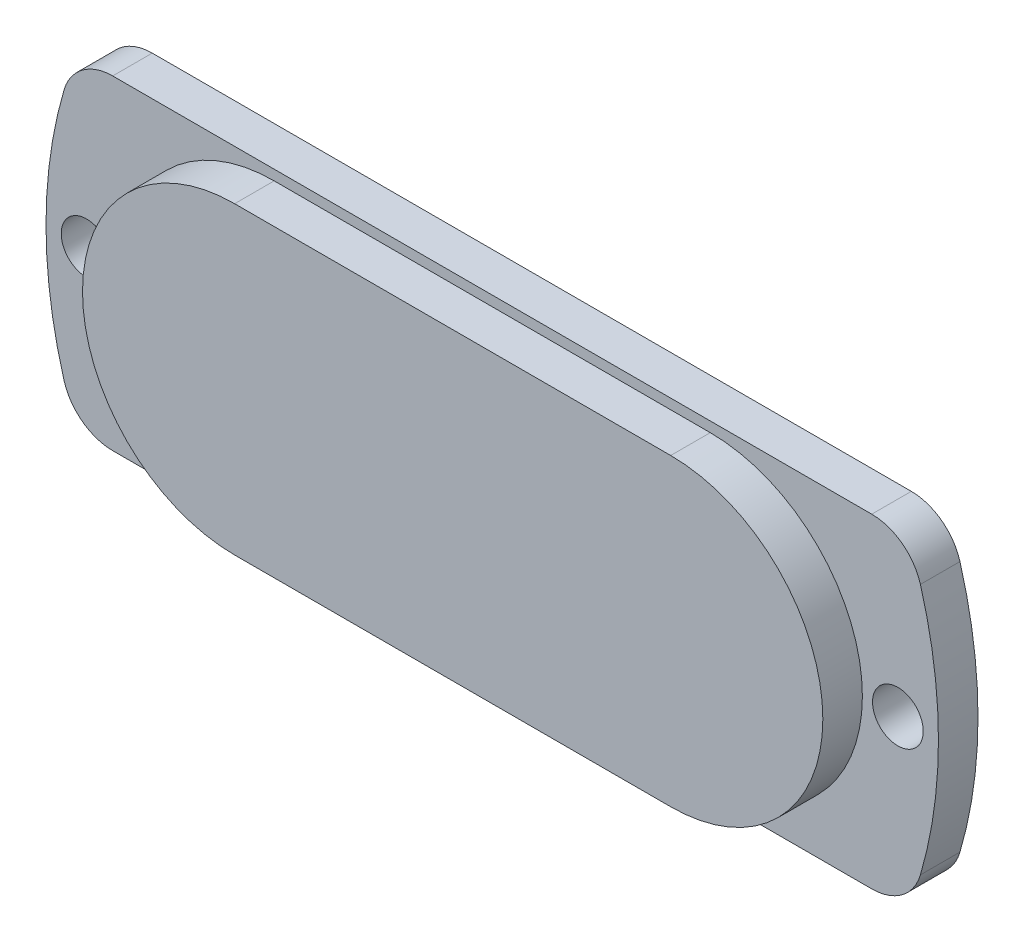
from build123d import *

# Parameters (mm, degrees)
SKETCH2_W            = 111.76
SKETCH2_H            = 40.64
SKETCH2_R            = 3.175
BOSS_EXTRUDE13_DEPTH = 4.953
BOSS_EXTRUDE14_DEPTH = 4.953
CUT_EXTRUDE1_DEPTH   = 61.279396447
FILLET1_R            = 6.35


with BuildPart() as part:
    # Sketch2 → Boss-Extrude13 (new body)
    with BuildSketch(Plane.XY):
        Rectangle(SKETCH2_W, SKETCH2_H)
        with Locations((-50.8, 0)):
            Circle(SKETCH2_R, mode=Mode.SUBTRACT)
        with Locations((50.8, 0)):
            Circle(SKETCH2_R, mode=Mode.SUBTRACT)
    extrude(amount=BOSS_EXTRUDE13_DEPTH)

    # Sketch3 → Boss-Extrude14 (add)
    with BuildSketch(Plane.XY.offset(4.953)):
        with BuildLine():
            Line((27.305, -19.05), (-27.305, -19.05))
            ThreePointArc((-27.305, -19.05), (-46.355, 0), (-27.305, 19.05))
            Line((-27.305, 19.05), (27.305, 19.05))
            ThreePointArc((27.305, 19.05), (46.355, 0), (27.305, -19.05))
        make_face()
    extrude(amount=BOSS_EXTRUDE14_DEPTH)

    # Sketch4 → Cut-Extrude1 (cut, through all)
    with BuildSketch(Plane(origin=(0, 0, 0), x_dir=(-1, 0, 0), z_dir=(0, 0, -1))):
        with BuildLine():
            ThreePointArc((-55.88, 1.9e-07), (-54.919272401, 10.337051172), (-52.07, 20.32))
            Line((-52.07, 20.32), (-55.88, 20.32))
            Line((-55.88, 20.32), (-55.88, 1.9e-07))
        make_face()
        with BuildLine():
            ThreePointArc((-52.07, -20.32), (-54.919272436, -10.337050985), (-55.88, 1.9e-07))
            Line((-55.88, 1.9e-07), (-55.88, -20.32))
            Line((-55.88, -20.32), (-52.07, -20.32))
        make_face()
        with BuildLine():
            Line((55.88, 20.32), (52.07, 20.32))
            ThreePointArc((52.07, 20.32), (54.919272419, 10.337051079), (55.88, 0))
            Line((55.88, 0), (55.88, 20.32))
        make_face()
        with BuildLine():
            Line((55.88, -20.32), (55.88, 0))
            ThreePointArc((55.88, 0), (54.919272419, -10.337051079), (52.07, -20.32))
            Line((52.07, -20.32), (55.88, -20.32))
        make_face()
    extrude(amount=-CUT_EXTRUDE1_DEPTH, mode=Mode.SUBTRACT)

    # Fillet1
    fillet1_edges = [part.edges().sort_by_distance(p)[0] for p in [
        (-52.07, 20.32, 2.4765),
        (-52.07, -20.32, 2.4765),
        (52.07, -20.32, 2.4765),
        (52.07, 20.32, 2.4765),
    ]]
    fillet(fillet1_edges, radius=FILLET1_R)


solid = part.part
